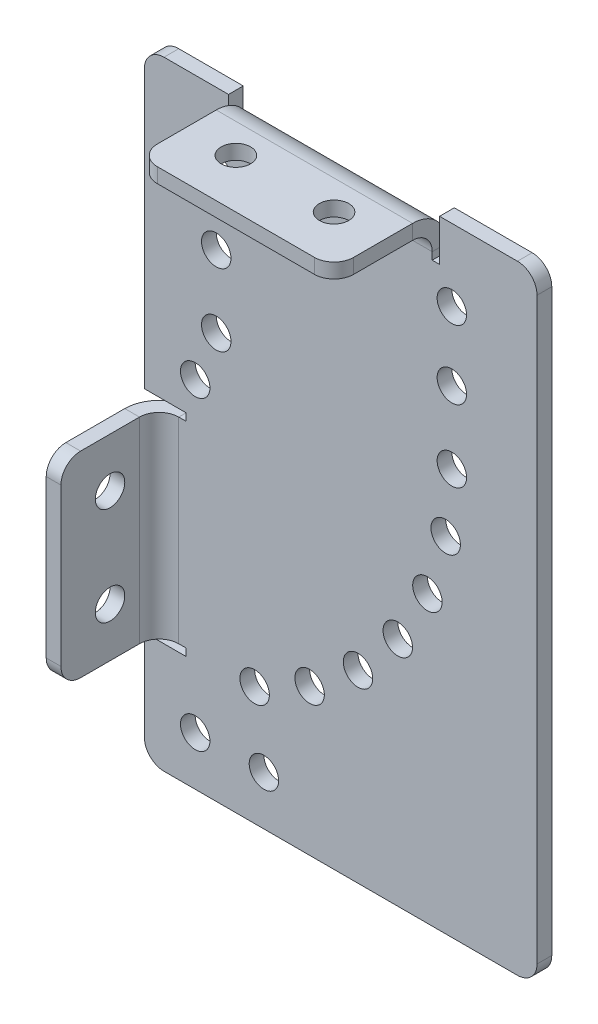
from build123d import *

# Parameters (mm, degrees)
SKETCH_1_R                        = 1.5
SM_BASE_FLANGE_2_DEPTH            = 1.5
SM_EDGE_FLANGE_2_STRIP_W          = 10
SM_EDGE_FLANGE_2_STRIP_H          = 1.5
SM_EDGE_FLANGE_2_STRIP_CUT_DEPTH  = 20
SM_EDGE_FLANGE_2_RELIEF_W         = 10.75
SM_EDGE_FLANGE_2_RELIEF_H         = 0.75
SM_EDGE_FLANGE_2_RELIEF_CUT_DEPTH = 1.5
SM_EDGE_FLANGE_2_DEPTH            = 20
SM_EDGE_FLANGE_2_PROFILE_R        = 1.5
SM_EDGE_FLANGE_2_FLAT_DEPTH       = 1.5
SM_EDGE_FLANGE_3_STRIP_W          = 10
SM_EDGE_FLANGE_3_STRIP_H          = 1.5
SM_EDGE_FLANGE_3_STRIP_CUT_DEPTH  = 20
SM_EDGE_FLANGE_3_RELIEF_W         = 10.75
SM_EDGE_FLANGE_3_RELIEF_H         = 0.75
SM_EDGE_FLANGE_3_RELIEF_CUT_DEPTH = 1.5
SM_EDGE_FLANGE_3_DEPTH            = 20
SM_EDGE_FLANGE_3_PROFILE_R        = 1.5
SM_EDGE_FLANGE_3_FLAT_DEPTH       = 1.5


# Sheet-metal steps are written as plain solids
with BuildPart() as part:
    # 草图1 → 基体-法兰2 (new body)
    with BuildSketch(Plane.XY):
        with BuildLine():
            Line((0, 34), (0, 22))
            Line((0, 22), (0, 10))
            Line((0, 10), (0, 7))
            Line((0, 7), (0, 2))
            ThreePointArc((0, 2), (0.585786438, 0.585786438), (2, 0))
            Line((2, 0), (38, 0))
            ThreePointArc((38, 0), (39.414213562, 0.585786438), (40, 2))
            Line((40, 2), (40, 61))
            ThreePointArc((40, 61), (39.414213562, 62.414213562), (38, 63))
            Line((38, 63), (34.32, 63))
            Line((34.32, 63), (4.32, 63))
            Line((4.32, 63), (2, 63))
            ThreePointArc((2, 63), (0.585786438, 62.414213562), (0, 61))
            Line((0, 61), (0, 41.32))
            Line((0, 41.32), (0, 37))
            Line((0, 37), (0, 34))
        make_face()
        with Locations((5.176021638, 36.143978362)):
            Circle(SKETCH_1_R, mode=Mode.SUBTRACT)
        with Locations((7.32, 41.32)):
            Circle(SKETCH_1_R, mode=Mode.SUBTRACT)
        with Locations((31.32, 41.32)):
            Circle(SKETCH_1_R, mode=Mode.SUBTRACT)
        with Locations((30.691436099, 35.076751631)):
            Circle(SKETCH_1_R, mode=Mode.SUBTRACT)
        with Locations((28.830973806, 29.08409589)):
            Circle(SKETCH_1_R, mode=Mode.SUBTRACT)
        with Locations((25.813288692, 23.582567072)):
            Circle(SKETCH_1_R, mode=Mode.SUBTRACT)
        with Locations((21.759505147, 18.792986533)):
            Circle(SKETCH_1_R, mode=Mode.SUBTRACT)
        with Locations((16.832334664, 14.907599318)):
            Circle(SKETCH_1_R, mode=Mode.SUBTRACT)
        with Locations((11.229544899, 12.082357801)):
            Circle(SKETCH_1_R, mode=Mode.SUBTRACT)
        with Locations((5.176021638, 5)):
            Circle(SKETCH_1_R, mode=Mode.SUBTRACT)
        with Locations((12.176021638, 5)):
            Circle(SKETCH_1_R, mode=Mode.SUBTRACT)
        with Locations((7.32, 55.66)):
            Circle(SKETCH_1_R, mode=Mode.SUBTRACT)
        with Locations((7.32, 48.66)):
            Circle(SKETCH_1_R, mode=Mode.SUBTRACT)
        with Locations((31.32, 55.66)):
            Circle(SKETCH_1_R, mode=Mode.SUBTRACT)
        with Locations((31.32, 48.66)):
            Circle(SKETCH_1_R, mode=Mode.SUBTRACT)
    extrude(amount=-SM_BASE_FLANGE_2_DEPTH)

    # 边线-法兰2 strip (across the edge) → 边线-法兰2 strip cut (cut)
    with BuildSketch(Plane(origin=(29.32, 63, 0), x_dir=(0, -1, 0), z_dir=(-1, 0, 0))):
        with Locations((-1.5, -0.75)):
            Rectangle(SM_EDGE_FLANGE_2_STRIP_W, SM_EDGE_FLANGE_2_STRIP_H)
    extrude(amount=SM_EDGE_FLANGE_2_STRIP_CUT_DEPTH, mode=Mode.SUBTRACT)

    # 边线-法兰2 relief (on the sheet) → 边线-法兰2 relief cut (cut)
    with BuildSketch(Plane(origin=(29.32, 59.5, 0), x_dir=(0, -1, 0), z_dir=(0, 0, 1))):
        with Locations((-4.625, 0.375)):
            Rectangle(SM_EDGE_FLANGE_2_RELIEF_W, SM_EDGE_FLANGE_2_RELIEF_H)
        with Locations((-4.625, -20.375)):
            Rectangle(SM_EDGE_FLANGE_2_RELIEF_W, SM_EDGE_FLANGE_2_RELIEF_H)
    extrude(amount=-SM_EDGE_FLANGE_2_RELIEF_CUT_DEPTH, mode=Mode.SUBTRACT)

    # 边线-法兰2 bend section (across the edge) → 边线-法兰2 (add)
    with BuildSketch(Plane(origin=(29.32, 63, 0), x_dir=(0, -1, 0), z_dir=(-1, 0, 0))):
        with BuildLine():
            Line((0, 2), (1.5, 2))
            ThreePointArc((1.5, 2), (2.085786438, 0.585786438), (3.5, 0))
            Line((3.5, 0), (3.5, -1.5))
            ThreePointArc((3.5, -1.5), (1.025126266, -0.474873734), (0, 2))
        make_face()
    extrude(amount=SM_EDGE_FLANGE_2_DEPTH)

    # 边线-法兰2 profile (on flange) → 边线-法兰2 flat (add)
    with BuildSketch(Plane(origin=(0, 63, 0), x_dir=(-1, 0, 0), z_dir=(0, 1, 0))):
        with BuildLine():
            Line((-29.32, 8), (-29.32, 2))
            Line((-29.32, 2), (-9.32, 2))
            Line((-9.32, 2), (-9.32, 8))
            ThreePointArc((-9.32, 8), (-9.905786438, 9.414213562), (-11.32, 10))
            Line((-11.32, 10), (-27.32, 10))
            ThreePointArc((-27.32, 10), (-28.734213562, 9.414213562), (-29.32, 8))
        make_face()
        with Locations((-24.32, 5)):
            Circle(SM_EDGE_FLANGE_2_PROFILE_R, mode=Mode.SUBTRACT)
        with Locations((-14.32, 5)):
            Circle(SM_EDGE_FLANGE_2_PROFILE_R, mode=Mode.SUBTRACT)
    extrude(amount=-SM_EDGE_FLANGE_2_FLAT_DEPTH)

    # 边线-法兰3 strip (across the edge) → 边线-法兰3 strip cut (cut)
    with BuildSketch(Plane.XZ.offset(-32)):
        with Locations((-1.5, -0.75)):
            Rectangle(SM_EDGE_FLANGE_3_STRIP_W, SM_EDGE_FLANGE_3_STRIP_H)
    extrude(amount=SM_EDGE_FLANGE_3_STRIP_CUT_DEPTH, mode=Mode.SUBTRACT)

    # 边线-法兰3 relief (on the sheet) → 边线-法兰3 relief cut (cut)
    with BuildSketch(Plane(origin=(3.5, 32, 0), x_dir=(1, 0, 0), z_dir=(0, 0, 1))):
        with Locations((-4.625, 0.375)):
            Rectangle(SM_EDGE_FLANGE_3_RELIEF_W, SM_EDGE_FLANGE_3_RELIEF_H)
        with Locations((-4.625, -20.375)):
            Rectangle(SM_EDGE_FLANGE_3_RELIEF_W, SM_EDGE_FLANGE_3_RELIEF_H)
    extrude(amount=-SM_EDGE_FLANGE_3_RELIEF_CUT_DEPTH, mode=Mode.SUBTRACT)

    # 边线-法兰3 bend section (across the edge) → 边线-法兰3 (add)
    with BuildSketch(Plane.XZ.offset(-32)):
        with BuildLine():
            Line((0, 2), (1.5, 2))
            ThreePointArc((1.5, 2), (2.085786438, 0.585786438), (3.5, 0))
            Line((3.5, 0), (3.5, -1.5))
            ThreePointArc((3.5, -1.5), (1.025126266, -0.474873734), (0, 2))
        make_face()
    extrude(amount=SM_EDGE_FLANGE_3_DEPTH)

    # 边线-法兰3 profile (on flange) → 边线-法兰3 flat (add)
    with BuildSketch(Plane(origin=(0, 0, 0), x_dir=(0, -1, 0), z_dir=(-1, 0, 0))):
        with BuildLine():
            Line((-32, 2), (-12, 2))
            Line((-12, 2), (-12, 8))
            ThreePointArc((-12, 8), (-12.585786438, 9.414213562), (-14, 10))
            Line((-14, 10), (-30, 10))
            ThreePointArc((-30, 10), (-31.414213562, 9.414213562), (-32, 8))
            Line((-32, 8), (-32, 2))
        make_face()
        with Locations((-17, 5)):
            Circle(SM_EDGE_FLANGE_3_PROFILE_R, mode=Mode.SUBTRACT)
        with Locations((-27, 5)):
            Circle(SM_EDGE_FLANGE_3_PROFILE_R, mode=Mode.SUBTRACT)
    extrude(amount=-SM_EDGE_FLANGE_3_FLAT_DEPTH)


solid = part.part
